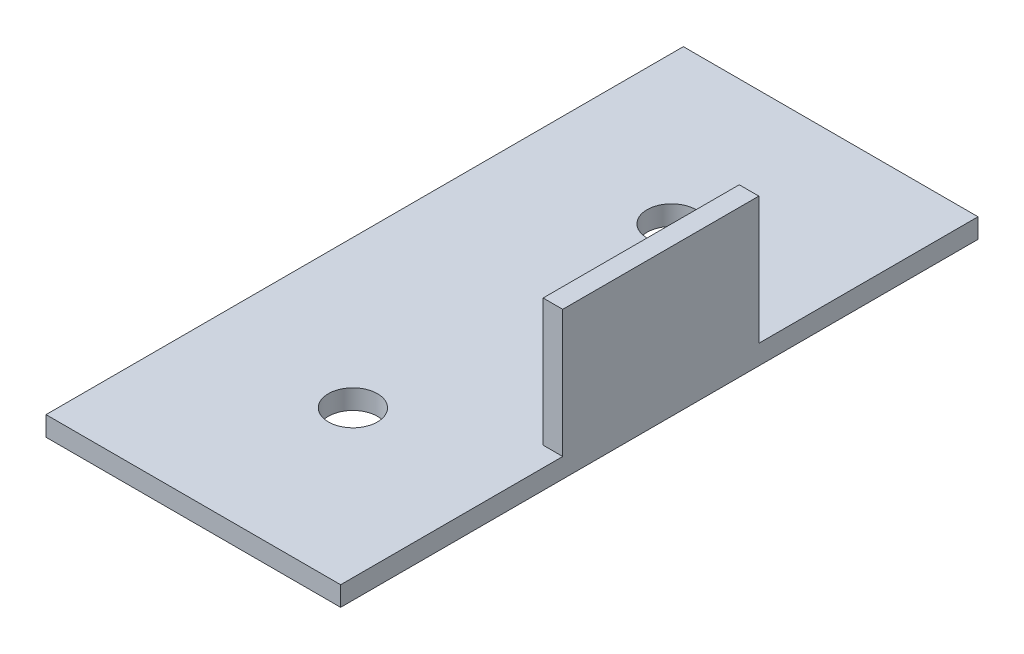
from build123d import *

# Parameters (mm, degrees)
EXTRUDE_1_DEPTH     = 20
SKETCH_4_W          = 20
SKETCH_4_H          = 16.999999963
CUT_EXTRUDE_1_DEPTH = 47.935226042
SKETCH_6_W          = 30.048551437
SKETCH_6_H          = 22.650000031
EXTRUDE_1_2_DEPTH   = 2
SKETCH_7_R          = 2.5
CUT_EXTRUDE_2_DEPTH = 53.675836409


with BuildPart() as part:
    # Эскиз1 → Extrude 1 (new body)
    with BuildSketch(Plane.XY):
        Polygon((0, 30), (0, 0), (-28.048551439, 0), (-28.048551439, -2), (2, -2), (2, 30), align=None)
    extrude(amount=EXTRUDE_1_DEPTH)

    # Эскиз4 → Вырез-Вытянуть1 (cut, through all)
    with BuildSketch(Plane(origin=(2, 0, 0), x_dir=(0, 0, -1), z_dir=(1, 0, 0))):
        with Locations((-10, 21.500000019)):
            Rectangle(SKETCH_4_W, SKETCH_4_H)
    extrude(amount=-CUT_EXTRUDE_1_DEPTH, mode=Mode.SUBTRACT)

    # Эскиз6 → Extrude 1 2 (add)
    with BuildSketch(Plane(origin=(0, 0, 0), x_dir=(1, 0, 0), z_dir=(0, 1, 0))):
        Polygon((-28.048551439, 0), (1.999999998, 0), (2.000000002, 22.349999969), (-28.048551439, 22.349999969), align=None)
        with Locations((-13.024275721, -31.325000016)):
            Rectangle(SKETCH_6_W, SKETCH_6_H)
    extrude(amount=-EXTRUDE_1_2_DEPTH)

    # Эскиз7 → Вырез-Вытянуть2 (cut, through all)
    with BuildSketch(Plane(origin=(0, 0, 0), x_dir=(1, 0, 0), z_dir=(0, 1, 0))):
        with Locations((-12.999999999, 6.09999997)):
            Circle(SKETCH_7_R)
        with Locations((-13.000000001, -26.40000003)):
            Circle(SKETCH_7_R)
    extrude(amount=-CUT_EXTRUDE_2_DEPTH, mode=Mode.SUBTRACT)


solid = part.part
